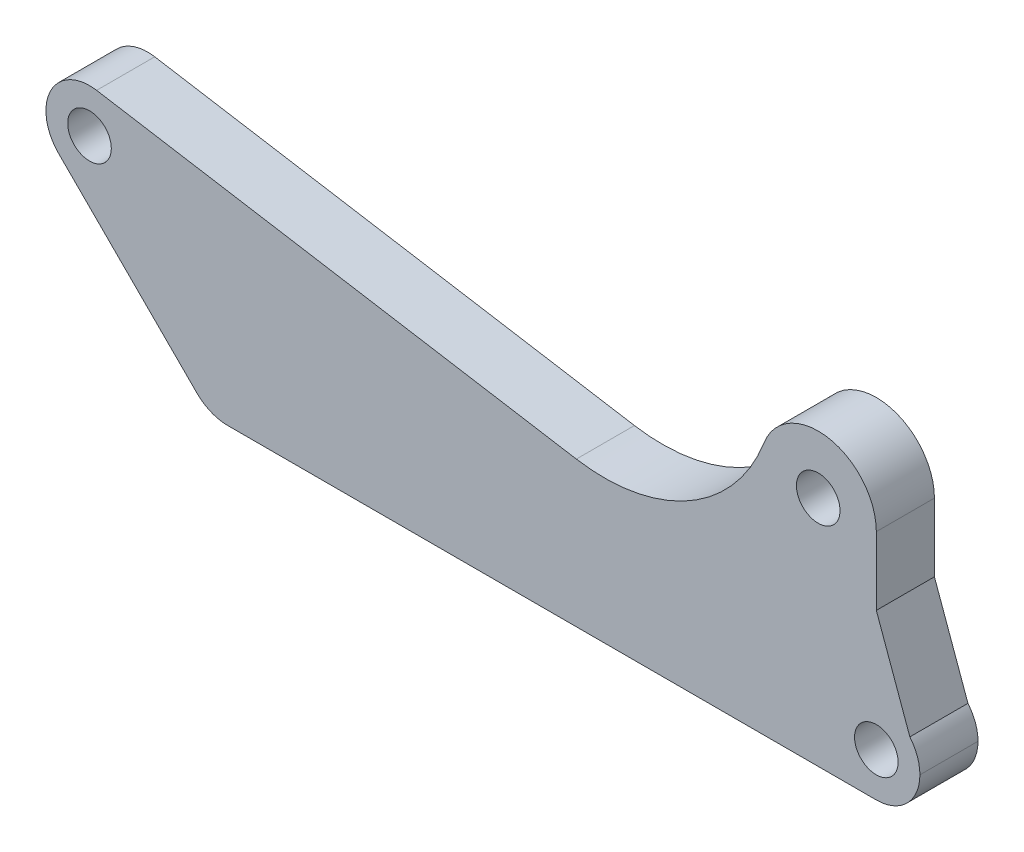
from build123d import *

# Parameters (mm, degrees)
SKETCH1_R           = 1.5
BOSS_EXTRUDE1_DEPTH = 4
FILLET3_R           = 3
CHAMFER1_DEPTH      = 4


with BuildPart() as part:
    # Sketch1 → Boss-Extrude1 (new body)
    with BuildSketch(Plane.XY):
        with BuildLine():
            Line((0, 0), (48.899957301, 0))
            Line((48.899957301, 0), (48.899957301, 6))
            Line((48.899957301, 6), (45.899957301, 6))
            Line((45.899957301, 6), (45.899957301, 16))
            ThreePointArc((45.899957301, 16), (42.622776894, 19.934149442), (38.161191383, 17.42184015))
            ThreePointArc((38.161191383, 17.42184015), (33.02844755, 11.405508249), (25.246040765, 10))
            Line((25.246040765, 10), (-7.780505141, 15.473258612))
            ThreePointArc((-7.780505141, 15.473258612), (-10.939117439, 13.885145013), (-10.392304845, 10.392304845))
            Line((-10.392304845, 10.392304845), (0, 0))
        make_face()
        with Locations((41.899957301, 16)):
            Circle(SKETCH1_R, mode=Mode.SUBTRACT)
        with Locations((-8.270984502, 12.513625189)):
            Circle(SKETCH1_R, mode=Mode.SUBTRACT)
        with Locations((45.899957301, 3)):
            Circle(SKETCH1_R, mode=Mode.SUBTRACT)
    extrude(amount=BOSS_EXTRUDE1_DEPTH)

    # Fillet3
    fillet3_edges = [part.edges().sort_by_distance(p)[0] for p in [
        (0, 0, 2),
        (48.899957301, 0, 2),
        (48.899957301, 6, 2),
    ]]
    fillet(fillet3_edges, radius=FILLET3_R - 0.0001)  # a hair under: the kernel refuses the full size

    # Chamfer1: read off the stored shape, not the designer's step
    # Chamfer1 outline → Chamfer1 (add)
    with BuildSketch(Plane.XY):
        with BuildLine():
            Line((48.207649608, 4.916913199), (45.899957301, 11.306623863))
            Line((45.899957301, 11.306623863), (45.899957301, 6))
            ThreePointArc((45.899957301, 6), (47.174567124, 5.715763207), (48.207649608, 4.916913199))
        make_face()
    extrude(amount=CHAMFER1_DEPTH)


solid = part.part
